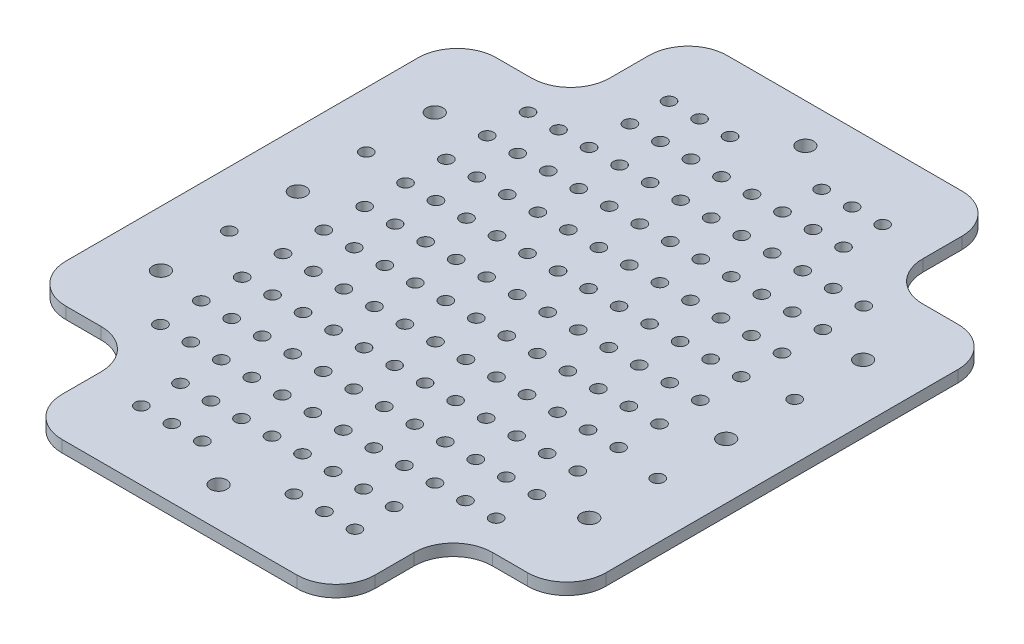
from build123d import *

# Parameters (mm, degrees)
SKETCH1_W           = 138
SKETCH1_H           = 170
BOSS_EXTRUDE1_DEPTH = 3
SKETCH2_R           = 1.6
SKETCH2_R_2         = 2.1
SKETCH2_W           = 29
SKETCH2_H           = 30
CUT_EXTRUDE1_DEPTH  = 3
SKETCH3_R           = 2.1
SKETCH3_R_2         = 1.6
CUT_EXTRUDE2_DEPTH  = 219.981734398
FILLET1_R           = 10


with BuildPart() as part:
    # Sketch1 → Boss-Extrude1 (new body)
    with BuildSketch(Plane(origin=(0, 0, 0), x_dir=(1, 0, 0), z_dir=(0, 1, 0))):
        with Locations((69, 85)):
            Rectangle(SKETCH1_W, SKETCH1_H)
    extrude(amount=BOSS_EXTRUDE1_DEPTH)

    # Sketch2 → Cut-Extrude1 (cut)
    with BuildSketch(Plane(origin=(0, 3, 0), x_dir=(1, 0, 0), z_dir=(0, 1, 0))):
        with Locations((33.9, 132)):
            Circle(SKETCH2_R)
        with Locations((41.7, 132)):
            Circle(SKETCH2_R)
        with Locations((49.5, 132)):
            Circle(SKETCH2_R)
        with Locations((57.3, 132)):
            Circle(SKETCH2_R)
        with Locations((65.1, 132)):
            Circle(SKETCH2_R)
        with Locations((72.9, 132)):
            Circle(SKETCH2_R)
        with Locations((80.7, 132)):
            Circle(SKETCH2_R)
        with Locations((88.5, 132)):
            Circle(SKETCH2_R)
        with Locations((96.3, 132)):
            Circle(SKETCH2_R)
        with Locations((41.7, 121.555555556)):
            Circle(SKETCH2_R)
        with Locations((49.5, 121.555555556)):
            Circle(SKETCH2_R)
        with Locations((57.3, 121.555555556)):
            Circle(SKETCH2_R)
        with Locations((65.1, 121.555555556)):
            Circle(SKETCH2_R)
        with Locations((72.9, 121.555555556)):
            Circle(SKETCH2_R)
        with Locations((80.7, 121.555555556)):
            Circle(SKETCH2_R)
        with Locations((88.5, 121.555555556)):
            Circle(SKETCH2_R)
        with Locations((96.3, 121.555555556)):
            Circle(SKETCH2_R)
        with Locations((41.7, 111.111111111)):
            Circle(SKETCH2_R)
        with Locations((49.5, 111.111111111)):
            Circle(SKETCH2_R)
        with Locations((57.3, 111.111111111)):
            Circle(SKETCH2_R)
        with Locations((65.1, 111.111111111)):
            Circle(SKETCH2_R)
        with Locations((72.9, 111.111111111)):
            Circle(SKETCH2_R)
        with Locations((80.7, 111.111111111)):
            Circle(SKETCH2_R)
        with Locations((88.5, 111.111111111)):
            Circle(SKETCH2_R)
        with Locations((96.3, 111.111111111)):
            Circle(SKETCH2_R)
        with Locations((41.7, 100.666666667)):
            Circle(SKETCH2_R)
        with Locations((49.5, 100.666666667)):
            Circle(SKETCH2_R)
        with Locations((57.3, 100.666666667)):
            Circle(SKETCH2_R)
        with Locations((65.1, 100.666666667)):
            Circle(SKETCH2_R)
        with Locations((72.9, 100.666666667)):
            Circle(SKETCH2_R)
        with Locations((80.7, 100.666666667)):
            Circle(SKETCH2_R)
        with Locations((88.5, 100.666666667)):
            Circle(SKETCH2_R)
        with Locations((96.3, 100.666666667)):
            Circle(SKETCH2_R)
        with Locations((41.7, 90.222222222)):
            Circle(SKETCH2_R)
        with Locations((49.5, 90.222222222)):
            Circle(SKETCH2_R)
        with Locations((57.3, 90.222222222)):
            Circle(SKETCH2_R)
        with Locations((65.1, 90.222222222)):
            Circle(SKETCH2_R)
        with Locations((72.9, 90.222222222)):
            Circle(SKETCH2_R)
        with Locations((80.7, 90.222222222)):
            Circle(SKETCH2_R)
        with Locations((88.5, 90.222222222)):
            Circle(SKETCH2_R)
        with Locations((96.3, 90.222222222)):
            Circle(SKETCH2_R)
        with Locations((41.7, 79.777777778)):
            Circle(SKETCH2_R)
        with Locations((49.5, 79.777777778)):
            Circle(SKETCH2_R)
        with Locations((57.3, 79.777777778)):
            Circle(SKETCH2_R)
        with Locations((65.1, 79.777777778)):
            Circle(SKETCH2_R)
        with Locations((72.9, 79.777777778)):
            Circle(SKETCH2_R)
        with Locations((80.7, 79.777777778)):
            Circle(SKETCH2_R)
        with Locations((88.5, 79.777777778)):
            Circle(SKETCH2_R)
        with Locations((96.3, 79.777777778)):
            Circle(SKETCH2_R)
        with Locations((41.7, 69.333333333)):
            Circle(SKETCH2_R)
        with Locations((49.5, 69.333333333)):
            Circle(SKETCH2_R)
        with Locations((57.3, 69.333333333)):
            Circle(SKETCH2_R)
        with Locations((65.1, 69.333333333)):
            Circle(SKETCH2_R)
        with Locations((72.9, 69.333333333)):
            Circle(SKETCH2_R)
        with Locations((80.7, 69.333333333)):
            Circle(SKETCH2_R)
        with Locations((88.5, 69.333333333)):
            Circle(SKETCH2_R)
        with Locations((96.3, 69.333333333)):
            Circle(SKETCH2_R)
        with Locations((41.7, 58.888888889)):
            Circle(SKETCH2_R)
        with Locations((49.5, 58.888888889)):
            Circle(SKETCH2_R)
        with Locations((57.3, 58.888888889)):
            Circle(SKETCH2_R)
        with Locations((65.1, 58.888888889)):
            Circle(SKETCH2_R)
        with Locations((72.9, 58.888888889)):
            Circle(SKETCH2_R)
        with Locations((80.7, 58.888888889)):
            Circle(SKETCH2_R)
        with Locations((88.5, 58.888888889)):
            Circle(SKETCH2_R)
        with Locations((96.3, 58.888888889)):
            Circle(SKETCH2_R)
        with Locations((41.7, 48.444444444)):
            Circle(SKETCH2_R)
        with Locations((49.5, 48.444444444)):
            Circle(SKETCH2_R)
        with Locations((57.3, 48.444444444)):
            Circle(SKETCH2_R)
        with Locations((65.1, 48.444444444)):
            Circle(SKETCH2_R)
        with Locations((72.9, 48.444444444)):
            Circle(SKETCH2_R)
        with Locations((80.7, 48.444444444)):
            Circle(SKETCH2_R)
        with Locations((88.5, 48.444444444)):
            Circle(SKETCH2_R)
        with Locations((96.3, 48.444444444)):
            Circle(SKETCH2_R)
        with Locations((41.7, 38)):
            Circle(SKETCH2_R)
        with Locations((49.5, 38)):
            Circle(SKETCH2_R)
        with Locations((57.3, 38)):
            Circle(SKETCH2_R)
        with Locations((65.1, 38)):
            Circle(SKETCH2_R)
        with Locations((72.9, 38)):
            Circle(SKETCH2_R)
        with Locations((80.7, 38)):
            Circle(SKETCH2_R)
        with Locations((88.5, 38)):
            Circle(SKETCH2_R)
        with Locations((96.3, 38)):
            Circle(SKETCH2_R)
        with Locations((33.9, 121.555555556)):
            Circle(SKETCH2_R)
        with Locations((33.9, 111.111111111)):
            Circle(SKETCH2_R)
        with Locations((33.9, 100.666666667)):
            Circle(SKETCH2_R)
        with Locations((33.9, 90.222222222)):
            Circle(SKETCH2_R)
        with Locations((33.9, 79.777777778)):
            Circle(SKETCH2_R)
        with Locations((33.9, 69.333333333)):
            Circle(SKETCH2_R)
        with Locations((33.9, 58.888888889)):
            Circle(SKETCH2_R)
        with Locations((33.9, 48.444444444)):
            Circle(SKETCH2_R)
        with Locations((33.9, 38)):
            Circle(SKETCH2_R)
        with Locations((104.1, 132)):
            Circle(SKETCH2_R)
        with Locations((104.1, 121.555555556)):
            Circle(SKETCH2_R)
        with Locations((104.1, 111.111111111)):
            Circle(SKETCH2_R)
        with Locations((104.1, 100.666666667)):
            Circle(SKETCH2_R)
        with Locations((104.1, 90.222222222)):
            Circle(SKETCH2_R)
        with Locations((104.1, 79.777777778)):
            Circle(SKETCH2_R)
        with Locations((104.1, 69.333333333)):
            Circle(SKETCH2_R)
        with Locations((104.1, 58.888888889)):
            Circle(SKETCH2_R)
        with Locations((104.1, 48.444444444)):
            Circle(SKETCH2_R)
        with Locations((104.1, 38)):
            Circle(SKETCH2_R)
        with Locations((69, 160)):
            Circle(SKETCH2_R_2)
        with Locations((69, 10)):
            Circle(SKETCH2_R_2)
        with Locations((14.5, 155)):
            Rectangle(SKETCH2_W, SKETCH2_H)
        with Locations((123.5, 155)):
            Rectangle(SKETCH2_W, SKETCH2_H)
        with Locations((123.5, 15)):
            Rectangle(SKETCH2_W, SKETCH2_H)
        with Locations((14.5, 15)):
            Rectangle(SKETCH2_W, SKETCH2_H)
    extrude(amount=-CUT_EXTRUDE1_DEPTH, mode=Mode.SUBTRACT)

    # Sketch3 → Cut-Extrude2 (cut, through all)
    with BuildSketch(Plane(origin=(0, 3, 0), x_dir=(1, 0, 0), z_dir=(0, 1, 0))):
        with Locations((14.25, 120)):
            Circle(SKETCH3_R)
        with Locations((14.25, 50)):
            Circle(SKETCH3_R)
        with Locations((14.25, 85)):
            Circle(SKETCH3_R)
        with Locations((123.75, 50)):
            Circle(SKETCH3_R)
        with Locations((123.75, 85)):
            Circle(SKETCH3_R)
        with Locations((123.75, 120)):
            Circle(SKETCH3_R)
        with Locations((41.7, 142.444444444)):
            Circle(SKETCH3_R_2)
        with Locations((49.5, 142.444444444)):
            Circle(SKETCH3_R_2)
        with Locations((57.3, 142.444444444)):
            Circle(SKETCH3_R_2)
        with Locations((65.1, 142.444444444)):
            Circle(SKETCH3_R_2)
        with Locations((72.9, 142.444444444)):
            Circle(SKETCH3_R_2)
        with Locations((80.7, 142.444444444)):
            Circle(SKETCH3_R_2)
        with Locations((88.5, 142.444444444)):
            Circle(SKETCH3_R_2)
        with Locations((96.3, 142.444444444)):
            Circle(SKETCH3_R_2)
        with Locations((49.5, 152.444444444)):
            Circle(SKETCH3_R_2)
        with Locations((57.3, 152.444444444)):
            Circle(SKETCH3_R_2)
        with Locations((80.7, 152.444444444)):
            Circle(SKETCH3_R_2)
        with Locations((88.5, 152.444444444)):
            Circle(SKETCH3_R_2)
        with Locations((96.3, 152.444444444)):
            Circle(SKETCH3_R_2)
        with Locations((41.7, 152.444444444)):
            Circle(SKETCH3_R_2)
        with Locations((96.3, 27.555555556)):
            Circle(SKETCH3_R_2)
        with Locations((88.5, 27.555555556)):
            Circle(SKETCH3_R_2)
        with Locations((80.7, 27.555555556)):
            Circle(SKETCH3_R_2)
        with Locations((72.9, 27.555555556)):
            Circle(SKETCH3_R_2)
        with Locations((65.1, 27.555555556)):
            Circle(SKETCH3_R_2)
        with Locations((57.3, 27.555555556)):
            Circle(SKETCH3_R_2)
        with Locations((49.5, 27.555555556)):
            Circle(SKETCH3_R_2)
        with Locations((41.7, 27.555555556)):
            Circle(SKETCH3_R_2)
        with Locations((41.7, 17.555555556)):
            Circle(SKETCH3_R_2)
        with Locations((96.3, 17.555555556)):
            Circle(SKETCH3_R_2)
        with Locations((88.5, 17.555555556)):
            Circle(SKETCH3_R_2)
        with Locations((80.7, 17.555555556)):
            Circle(SKETCH3_R_2)
        with Locations((57.3, 17.555555556)):
            Circle(SKETCH3_R_2)
        with Locations((49.5, 17.555555556)):
            Circle(SKETCH3_R_2)
        with Locations((26.1, 132)):
            Circle(SKETCH3_R_2)
        with Locations((26.1, 121.56)):
            Circle(SKETCH3_R_2)
        with Locations((26.1, 111.12)):
            Circle(SKETCH3_R_2)
        with Locations((26.1, 100.68)):
            Circle(SKETCH3_R_2)
        with Locations((26.1, 90.24)):
            Circle(SKETCH3_R_2)
        with Locations((26.1, 79.8)):
            Circle(SKETCH3_R_2)
        with Locations((26.1, 69.36)):
            Circle(SKETCH3_R_2)
        with Locations((26.1, 58.92)):
            Circle(SKETCH3_R_2)
        with Locations((26.1, 48.48)):
            Circle(SKETCH3_R_2)
        with Locations((26.1, 38.04)):
            Circle(SKETCH3_R_2)
        with Locations((111.9, 132)):
            Circle(SKETCH3_R_2)
        with Locations((111.9, 48.48)):
            Circle(SKETCH3_R_2)
        with Locations((111.9, 58.92)):
            Circle(SKETCH3_R_2)
        with Locations((111.9, 69.36)):
            Circle(SKETCH3_R_2)
        with Locations((111.9, 79.8)):
            Circle(SKETCH3_R_2)
        with Locations((111.9, 90.24)):
            Circle(SKETCH3_R_2)
        with Locations((111.9, 100.68)):
            Circle(SKETCH3_R_2)
        with Locations((111.9, 111.12)):
            Circle(SKETCH3_R_2)
        with Locations((111.9, 121.56)):
            Circle(SKETCH3_R_2)
        with Locations((111.9, 38.04)):
            Circle(SKETCH3_R_2)
        with Locations((14.25, 102.5)):
            Circle(SKETCH3_R_2)
        with Locations((14.25, 67.5)):
            Circle(SKETCH3_R_2)
        with Locations((123.75, 67.5)):
            Circle(SKETCH3_R_2)
        with Locations((123.75, 102.5)):
            Circle(SKETCH3_R_2)
    extrude(amount=-CUT_EXTRUDE2_DEPTH, mode=Mode.SUBTRACT)

    # Fillet1
    fillet1_edges = [part.edges().sort_by_distance(p)[0] for p in [
        (29, 1.5, -170),
        (29, 1.5, -140),
        (0, 1.5, -140),
        (0, 1.5, -30),
        (29, 1.5, -30),
        (29, 1.5, 0),
        (109, 1.5, 0),
        (109, 1.5, -30),
        (138, 1.5, -30),
        (109, 1.5, -140),
        (138, 1.5, -140),
        (109, 1.5, -170),
    ]]
    fillet(fillet1_edges, radius=FILLET1_R)


solid = part.part
